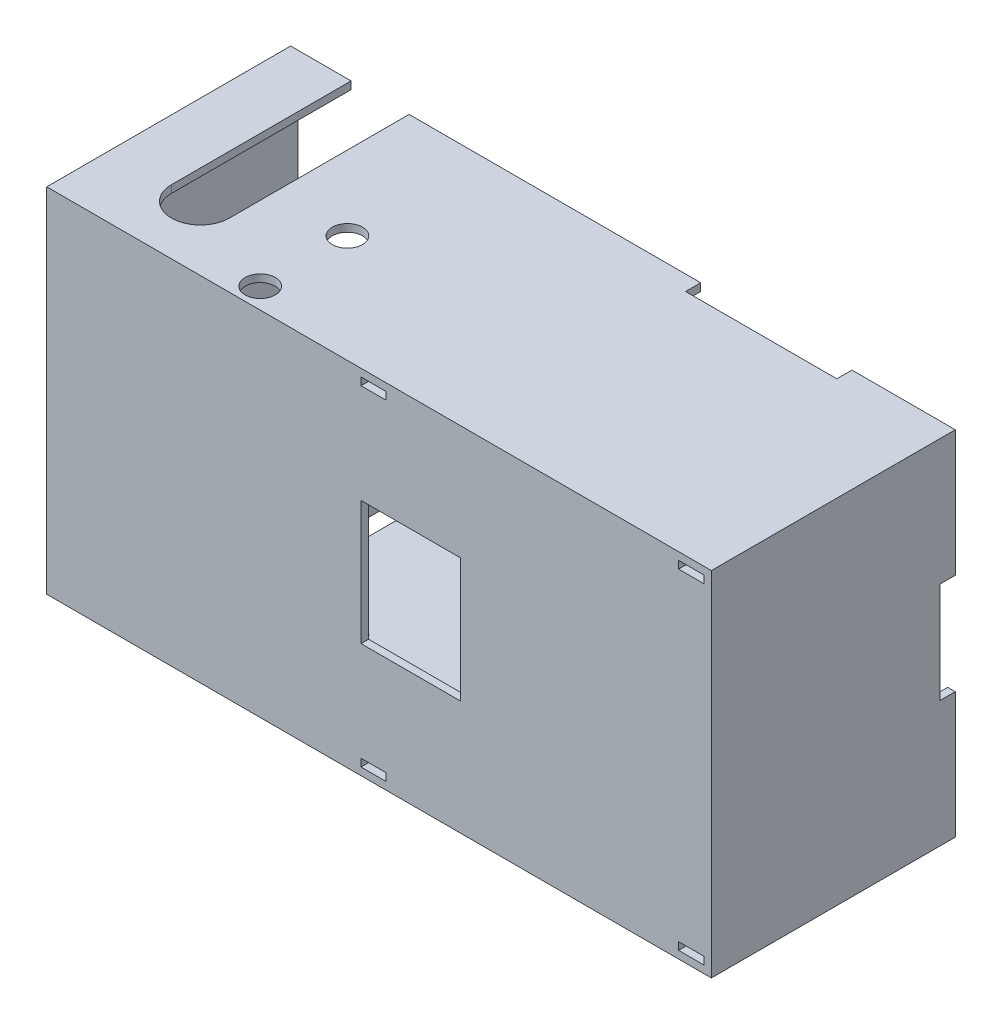
from build123d import *

# Parameters (mm, degrees)
SKETCH1_W                = 131.85
SKETCH1_H                = 70
BOSS_EXTRUDE1_DEPTH      = 1.5
SKETCH1_5_W              = 131.85
SKETCH1_5_H              = 70
SKETCH1_5_W_2            = 128.85
SKETCH1_5_H_2            = 67
BOSS_EXTRUDE2_DEPTH      = 46.887495374
SKETCH2_W                = 5.8
SKETCH2_H                = 7.525
BOSS_EXTRUDE3_DEPTH      = 67
CAVITY1_START            = -114.930353249
CAVITY1_DEPTH            = 49.266
CAVITY1_2_DEPTH          = 37.332
CAVITY1_START_2          = -120.030353249
CAVITY1_3_OUTLINE_W      = 2.55
CAVITY1_3_OUTLINE_H      = 5.1
CAVITY1_3_DEPTH          = 0.430353249
CAVITY1_START_3          = -9.75
CAVITY1_4_DEPTH          = 70
SKETCH5_W                = 8.75
SKETCH5_H                = 5
BOSS_EXTRUDE4_DEPTH      = 22.5
CUT_EXTRUDE3_REACH       = 139.739
SKETCH6_R                = 1.5
SKETCH6_R_2              = 1
CUT_EXTRUDE18_DEPTH      = 1.15
CUT_EXTRUDE18_DEPTH_BACK = 1.15
CUT_EXTRUDE18_START      = -2.5
CUT_EXTRUDE19_DEPTH      = 1.15
CUT_EXTRUDE19_DEPTH_BACK = 1.15
CUT_EXTRUDE19_START      = -19.7
SKETCH9_W                = 32.1
SKETCH9_H                = 12.2
SKETCH9_W_2              = 3.3625
BOSS_EXTRUDE5_DEPTH      = 40.087495374
SKETCH10_W               = 22.5
SKETCH10_H               = 15.7
CUT_EXTRUDE6_DEPTH       = 12.2
SKETCH11_R               = 0.75
CUT_EXTRUDE7_DEPTH       = 8
CUT_EXTRUDE9_REACH       = 149.525
SKETCH17_W               = 2.4375
SKETCH17_H               = 12.2
CUT_EXTRUDE13_DEPTH      = 7.525
SKETCH20_W               = 2.5
SKETCH20_H               = 3
BOSSBATTERYSTUBS_DEPTH   = 5.75
MIRROR10_COPY_1_SKETCH_W = 2.5
MIRROR10_COPY_1_SKETCH_H = 3
MIRROR10_COPY_1_DEPTH    = 5.75
SKETCH21_W               = 8
SKETCH21_H               = 4.2
BOSS_EXTRUDE6_DEPTH      = 1.35
MIRROR12_COPY_1_SKETCH_W = 8
MIRROR12_COPY_1_SKETCH_H = 4.2
MIRROR12_COPY_1_DEPTH    = 1.35
CUT_EXTRUDE16_REACH      = 145.655
SKETCH22_W               = 5
SKETCH22_H               = 1.5
SKETCH23_W               = 5
SKETCH23_H               = 1.5
CUT_EXTRUDE17_DEPTH      = 3
CUT_EXTRUDE23_REACH      = 145.156
SKETCH27_W               = 19.75
SKETCH27_H               = 24.6
CUT_EXTRUDE15_START      = -5.25
SKETCH19_R               = 3
CUT_EXTRUDE15_DEPTH      = 5.25
CUT_EXTRUDE24_START      = -5.25
SKETCH28_R               = 3
CUT_EXTRUDE24_DEPTH      = 5.25
CUT_EXTRUDE25_REACH      = 117.926
SKETCH29_W               = 8
SKETCH29_H               = 3
SKETCH30_W               = 5.1
SKETCH30_H               = 2.55
BOSSFRONTCAVITYFIX_DEPTH = 0.430353249
CUT_EXTRUDE26_DEPTH      = 4.8
CUT_EXTRUDE27_REACH      = 149.525
SKETCH32_W               = 30
SKETCH32_H               = 3
CUT_EXTRUDE28_REACH      = 154.358
SKETCH33_W               = 3
SKETCH33_H               = 20


# Read off the part's stored shape, not the designer's step: Cavity1
with BuildPart() as part:
    # Sketch1 → Boss-Extrude1 (new body)
    with BuildSketch(Plane.XY):
        with Locations((-55.175, 25.25)):
            Rectangle(SKETCH1_W, SKETCH1_H)
    extrude(amount=BOSS_EXTRUDE1_DEPTH)

    # Sketch1<5> → Boss-Extrude2 (add)
    with BuildSketch(Plane.XY):
        with Locations((-55.175, 25.25)):
            Rectangle(SKETCH1_5_W, SKETCH1_5_H)
        with Locations((-55.175, 25.25)):
            Rectangle(SKETCH1_5_W_2, SKETCH1_5_H_2, mode=Mode.SUBTRACT)
    extrude(amount=-BOSS_EXTRUDE2_DEPTH)

    # Sketch2 → Boss-Extrude3 (add)
    with BuildSketch(Plane.XZ.offset(-58.75)):
        with Locations((-76.95, -3.7625)):
            Rectangle(SKETCH2_W, SKETCH2_H)
    extrude(amount=BOSS_EXTRUDE3_DEPTH)

    # Cavity1 outline → Cavity1 (cut)
    with BuildSketch(Plane.YZ.offset(CAVITY1_START)):
        with BuildLine():
            Line((36.166540929, -4.011412776), (36.166540929, -7.525))
            Line((36.166540929, -7.525), (53.710540929, -7.525))
            Line((53.710540929, -7.525), (53.710540929, -4.011412776))
            ThreePointArc((53.710540929, -4.011412776), (44.938540929, 0.123), (36.166540929, -4.011412776))
        make_face()
        with BuildLine():
            Line((14.333459071, -7.525), (14.333459071, -4.011412776))
            ThreePointArc((14.333459071, -4.011412776), (5.561459071, 0.123), (-3.210540929, -4.011412776))
            Line((-3.210540929, -4.011412776), (-3.210540929, -7.525))
            Line((-3.210540929, -7.525), (14.333459071, -7.525))
        make_face()
    extrude(amount=CAVITY1_DEPTH, mode=Mode.SUBTRACT)

    # Cavity1 2 outline → Cavity1 2 (cut)
    with BuildSketch(Plane.YZ.offset(CAVITY1_START)):
        with BuildLine():
            Line((55.189540929, 0.225), (36.166540929, 0.225))
            Line((36.166540929, 0.225), (36.166540929, -4.011412776))
            ThreePointArc((36.166540929, -4.011412776), (44.938540929, 0.123), (53.710540929, -4.011412776))
            Line((53.710540929, -4.011412776), (53.710540929, -7.525))
            Line((53.710540929, -7.525), (55.189540929, -7.525))
            Line((55.189540929, -7.525), (55.189540929, 0.225))
        make_face()
        with BuildLine():
            Line((14.333459071, -4.011412776), (14.333459071, 0.225))
            Line((14.333459071, 0.225), (-4.689540929, 0.225))
            Line((-4.689540929, 0.225), (-4.689540929, -7.525))
            Line((-4.689540929, -7.525), (-3.210540929, -7.525))
            Line((-3.210540929, -7.525), (-3.210540929, -4.011412776))
            ThreePointArc((-3.210540929, -4.011412776), (5.561459071, 0.123), (14.333459071, -4.011412776))
        make_face()
    extrude(amount=CAVITY1_2_DEPTH, mode=Mode.SUBTRACT)

    # Cavity1 3 outline → Cavity1 3 (cut)
    with BuildSketch(Plane.YZ.offset(CAVITY1_START_2)):
        with Locations((44.938540929, -11.25)):
            Rectangle(CAVITY1_3_OUTLINE_W, CAVITY1_3_OUTLINE_H)
        with Locations((5.561459071, -11.25)):
            Rectangle(CAVITY1_3_OUTLINE_W, CAVITY1_3_OUTLINE_H)
    extrude(amount=CAVITY1_3_DEPTH, mode=Mode.SUBTRACT)

    # Cavity1 4 outline → Cavity1 4 (cut)
    with BuildSketch(Plane(origin=(0, 0, 0), x_dir=(1, 0, 0), z_dir=(0, 1, 0)).offset(CAVITY1_START_3)):
        with BuildLine():
            Line((-105.571853249, 13.174532151), (-105.571853249, 9.325467849))
            ThreePointArc((-105.571853249, 9.325467849), (-103.710353249, 8.5725), (-101.848853249, 9.325467849))
            Line((-101.848853249, 9.325467849), (-101.848853249, 13.174532151))
            ThreePointArc((-101.848853249, 13.174532151), (-103.710353249, 13.9275), (-105.571853249, 13.174532151))
        make_face()
    extrude(amount=CAVITY1_4_DEPTH, mode=Mode.SUBTRACT)

    # Sketch5 → Boss-Extrude4 (add)
    with BuildSketch(Plane(origin=(0, 0, 0), x_dir=(-1, 0, 0), z_dir=(0, 0, -1))):
        with Locations((82.85, 33.85)):
            Rectangle(SKETCH5_W, SKETCH5_H)
    boss_extrude4 = extrude(amount=BOSS_EXTRUDE4_DEPTH)

    # Sketch6 → Cut-Extrude3 (cut, up to next)
    with BuildSketch(Plane(origin=(0, 36.166540929, 0), x_dir=(1, 0, 0), z_dir=(0, 1, 0)), mode=Mode.PRIVATE) as cut_extrude3_sk1:
        with Locations(Location((-82.85, 19.9, 0), (0, 0, 270))):
            Circle(SKETCH6_R)
    cut_extrude3_tool1 = extrude(cut_extrude3_sk1.sketch, amount=-CUT_EXTRUDE3_REACH, mode=Mode.PRIVATE) & part.part
    # Sketch6 → Cut-Extrude3 (cut, up to next)
    with BuildSketch(Plane(origin=(0, 36.166540929, 0), x_dir=(1, 0, 0), z_dir=(0, 1, 0)), mode=Mode.PRIVATE) as cut_extrude3_sk2:
        with Locations(Location((-82.85, 2.6, 0), (0, 0, 270))):
            Circle(SKETCH6_R_2)
    cut_extrude3_tool2 = extrude(cut_extrude3_sk2.sketch, amount=-CUT_EXTRUDE3_REACH, mode=Mode.PRIVATE) & part.part
    cut_extrude3_1 = cut_extrude3_tool1.solids().sort_by_distance((-82.85, 36.166541, -19.9))[0]
    add(cut_extrude3_1, mode=Mode.SUBTRACT)
    cut_extrude3_2 = cut_extrude3_tool2.solids().sort_by_distance((-82.85, 36.166541, -2.6))[0]
    add(cut_extrude3_2, mode=Mode.SUBTRACT)
    cut_extrude3 = cut_extrude3_1 + cut_extrude3_2  # Cut-Extrude3 as one shape, for the pattern or mirror that repeats it

    # Sketch24 → Cut-Extrude18 (cut, two sides: drawn at the far end of the back side and taken through both)
    with BuildSketch(Plane(origin=(0, 36.35, 0), x_dir=(1, 0, 0), z_dir=(0, 1, 0)).offset(CUT_EXTRUDE18_START - CUT_EXTRUDE18_DEPTH_BACK)):
        Polygon((-82.85, 16.637970979), (-80.025, 18.26898549), (-80.025, 22.5), (-85.675, 22.5), (-85.675, 18.26898549), align=None)
    extrude(amount=CUT_EXTRUDE18_DEPTH + CUT_EXTRUDE18_DEPTH_BACK, mode=Mode.SUBTRACT)

    # Mirror15: Boss-Extrude4, Cut-Extrude3 across plane
    add(boss_extrude4.mirror(Plane(origin=(0, 25.25, 0), x_dir=(0, 0, 1), z_dir=(0, -1, 0))))
    add(cut_extrude3.mirror(Plane(origin=(0, 25.25, 0), x_dir=(0, 0, 1), z_dir=(0, -1, 0))), mode=Mode.SUBTRACT)

    # Sketch24<2> → Cut-Extrude19 (cut, two sides: drawn at the far end of the back side and taken through both)
    with BuildSketch(Plane(origin=(0, 36.35, 0), x_dir=(1, 0, 0), z_dir=(0, 1, 0)).offset(CUT_EXTRUDE19_START - CUT_EXTRUDE19_DEPTH_BACK)):
        Polygon((-82.85, 16.637970979), (-80.025, 18.26898549), (-80.025, 22.5), (-85.675, 22.5), (-85.675, 18.26898549), align=None)
    extrude(amount=CUT_EXTRUDE19_DEPTH + CUT_EXTRUDE19_DEPTH_BACK, mode=Mode.SUBTRACT)

    # Sketch9 → Boss-Extrude5 (add)
    with BuildSketch(Plane(origin=(0, 0, 0), x_dir=(-1, 0, 0), z_dir=(0, 0, -1))):
        with Locations((92.5375, 25.25)):
            Rectangle(SKETCH9_W, SKETCH9_H)
        with Locations((78.16875, 25.25)):
            Rectangle(SKETCH9_W_2, SKETCH9_H)
    extrude(amount=BOSS_EXTRUDE5_DEPTH)

    # Sketch10 → Cut-Extrude6 (cut)
    with BuildSketch(Plane(origin=(0, 31.35, 0), x_dir=(1, 0, 0), z_dir=(0, 1, 0))):
        with Locations((-92.5375, 32.237495374)):
            Rectangle(SKETCH10_W, SKETCH10_H)
    extrude(amount=-CUT_EXTRUDE6_DEPTH, mode=Mode.SUBTRACT)

    # Sketch11 → Cut-Extrude7 (cut)
    with BuildSketch(Plane(origin=(0, 0, -40.087495374), x_dir=(-1, 0, 0), z_dir=(0, 0, -1))):
        with Locations((106.1875, 25.25)):
            Circle(SKETCH11_R)
    cut_extrude7 = extrude(amount=-CUT_EXTRUDE7_DEPTH, mode=Mode.SUBTRACT)

    # Sketch13 → Cut-Extrude9 (cut, up to next)
    with BuildSketch(Plane(origin=(0, 60.25, 0), x_dir=(1, 0, 0), z_dir=(0, 1, 0)), mode=Mode.PRIVATE) as cut_extrude9_sk1:
        with BuildLine():
            Line((-109.1, 46.887495374), (-109.1, 11.25))
            ThreePointArc((-109.1, 11.25), (-103.35, 5.5), (-97.6, 11.25))
            Line((-97.6, 11.25), (-97.6, 46.887495374))
            Line((-97.6, 46.887495374), (-109.1, 46.887495374))
        make_face()
        with BuildLine():
            Line((-105.571853249, 9.325467849), (-105.571853249, 13.174532151))
            ThreePointArc((-105.571853249, 13.174532151), (-103.710353249, 13.9275), (-101.848853249, 13.174532151))
            Line((-101.848853249, 13.174532151), (-101.848853249, 9.325467849))
            ThreePointArc((-101.848853249, 9.325467849), (-103.710353249, 8.5725), (-105.571853249, 9.325467849))
        make_face(mode=Mode.SUBTRACT)
    cut_extrude9_tool1 = extrude(cut_extrude9_sk1.sketch, amount=-CUT_EXTRUDE9_REACH, mode=Mode.PRIVATE) & part.part
    cut_extrude9 = cut_extrude9_tool1.solids().sort_by_distance((-103.335225, 60.25, -27.427392))[0]
    add(cut_extrude9, mode=Mode.SUBTRACT)

    # Mirror4: Cut-Extrude9 across plane
    add(cut_extrude9.mirror(Plane(origin=(0, 25.25, 0), x_dir=(0, 0, 1), z_dir=(0, -1, 0))), mode=Mode.SUBTRACT)

    # Sketch17 → Cut-Extrude13 (cut)
    with BuildSketch(Plane(origin=(0, 0, -7.525), x_dir=(-1, 0, 0), z_dir=(0, 0, -1))):
        with Locations((75.26875, 25.25)):
            Rectangle(SKETCH17_W, SKETCH17_H)
    extrude(amount=-CUT_EXTRUDE13_DEPTH, mode=Mode.SUBTRACT)

    # Sketch20 → BossBatteryStubs (add)
    with BuildSketch(Plane(origin=(0, 0, 0), x_dir=(-1, 0, 0), z_dir=(0, 0, -1))):
        with Locations((29.25, 57.25)):
            Rectangle(SKETCH20_W, SKETCH20_H)
    bossbatterystubs = extrude(amount=BOSSBATTERYSTUBS_DEPTH)

    # Mirror9: BossBatteryStubs across plane
    add(bossbatterystubs.mirror(Plane.ZY.offset(19.5)))

    # Mirror10: BossBatteryStubs across plane
    add(bossbatterystubs.mirror(Plane(origin=(0, 25.25, 0), x_dir=(0, 0, 1), z_dir=(0, -1, 0))))

    # Mirror10 copy 1 sketch → Mirror10 copy 1 (add)
    with BuildSketch(Plane(origin=(-39, 50.5, 0), x_dir=(1, 0, 0), z_dir=(0, 0, -1))):
        with Locations((29.25, 57.25)):
            Rectangle(MIRROR10_COPY_1_SKETCH_W, MIRROR10_COPY_1_SKETCH_H)
    extrude(amount=MIRROR10_COPY_1_DEPTH)

    # Sketch21 → Boss-Extrude6 (add)
    with BuildSketch(Plane.XZ.offset(-58.75)):
        with Locations((5.25, -41.637495374)):
            Rectangle(SKETCH21_W, SKETCH21_H)
    boss_extrude6 = extrude(amount=BOSS_EXTRUDE6_DEPTH)

    # Mirror11: Boss-Extrude6 across plane
    add(boss_extrude6.mirror(Plane(origin=(-55.175, 0, 0), x_dir=(0, 0, 1), z_dir=(1, 0, 0))))

    # Mirror12: Boss-Extrude6 across plane
    add(boss_extrude6.mirror(Plane(origin=(0, 25.25, 0), x_dir=(0, 0, 1), z_dir=(0, -1, 0))))

    # Mirror12 copy 1 sketch → Mirror12 copy 1 (add)
    with BuildSketch(Plane(origin=(-110.35, -8.25, 0), x_dir=(-1, 0, 0), z_dir=(0, 1, 0))):
        with Locations((5.25, -41.637495374)):
            Rectangle(MIRROR12_COPY_1_SKETCH_W, MIRROR12_COPY_1_SKETCH_H)
    extrude(amount=MIRROR12_COPY_1_DEPTH)

    # Sketch22 → Cut-Extrude16 (cut, up to next)
    with BuildSketch(Plane.XY.offset(1.5), mode=Mode.PRIVATE) as cut_extrude16_sk1:
        with Locations((6.75, 58)):
            Rectangle(SKETCH22_W, SKETCH22_H)
    cut_extrude16_tool1 = extrude(cut_extrude16_sk1.sketch, amount=-CUT_EXTRUDE16_REACH, mode=Mode.PRIVATE) & part.part
    cut_extrude16 = cut_extrude16_tool1.solids().sort_by_distance((6.75, 58, 1.5))[0]
    add(cut_extrude16, mode=Mode.SUBTRACT)

    # Sketch23 → Cut-Extrude17 (cut)
    with BuildSketch(Plane.XY.offset(1.5)):
        with Locations((-56.25, 58)):
            Rectangle(SKETCH23_W, SKETCH23_H)
    cut_extrude17 = extrude(amount=-CUT_EXTRUDE17_DEPTH, mode=Mode.SUBTRACT)

    # Mirror13: Cut-Extrude16, Cut-Extrude17 across plane
    add(cut_extrude16.mirror(Plane(origin=(0, 25.25, 0), x_dir=(0, 0, 1), z_dir=(0, -1, 0))), mode=Mode.SUBTRACT)
    add(cut_extrude17.mirror(Plane(origin=(0, 25.25, 0), x_dir=(0, 0, 1), z_dir=(0, -1, 0))), mode=Mode.SUBTRACT)

    # Mirror14: Cut-Extrude7 across plane
    add(cut_extrude7.mirror(Plane(origin=(-92.5375, 0, 0), x_dir=(0, 0, 1), z_dir=(1, 0, 0))), mode=Mode.SUBTRACT)

    # Sketch27 → Cut-Extrude23 (cut, up to next)
    with BuildSketch(Plane(origin=(0, 0, 0), x_dir=(-1, 0, 0), z_dir=(0, 0, -1)), mode=Mode.PRIVATE) as cut_extrude23_sk1:
        with Locations((48.875, 25.25)):
            Rectangle(SKETCH27_W, SKETCH27_H)
    cut_extrude23_tool1 = extrude(cut_extrude23_sk1.sketch, amount=-CUT_EXTRUDE23_REACH, mode=Mode.PRIVATE) & part.part
    add(cut_extrude23_tool1.solids().sort_by_distance((-48.875, 25.25, 0))[0], mode=Mode.SUBTRACT)

    # Sketch19 → Cut-Extrude15 (cut)
    with BuildSketch(Plane.XZ.offset(9.75).offset(CUT_EXTRUDE15_START)):
        with Locations((-82.85, -19.9)):
            Circle(SKETCH19_R)
        with Locations((-82.85, -2.6)):
            Circle(SKETCH19_R)
    extrude(amount=CUT_EXTRUDE15_DEPTH, mode=Mode.SUBTRACT)

    # Sketch28 → Cut-Extrude24 (cut)
    with BuildSketch(Plane(origin=(0, 60.25, 0), x_dir=(1, 0, 0), z_dir=(0, 1, 0)).offset(CUT_EXTRUDE24_START)):
        with Locations((-82.85, 19.9)):
            Circle(SKETCH28_R)
        with Locations((-82.85, 2.6)):
            Circle(SKETCH28_R)
    extrude(amount=CUT_EXTRUDE24_DEPTH, mode=Mode.SUBTRACT)

    # Sketch29 → Cut-Extrude25 (cut, up to next)
    with BuildSketch(Plane(origin=(-76.4875, 0, 0), x_dir=(0, 0, -1), z_dir=(1, 0, 0)), mode=Mode.PRIVATE) as cut_extrude25_sk1:
        with Locations((28.387495374, 25.25)):
            Rectangle(SKETCH29_W, SKETCH29_H)
    cut_extrude25_tool1 = extrude(cut_extrude25_sk1.sketch, amount=-CUT_EXTRUDE25_REACH, mode=Mode.PRIVATE) & part.part
    add(cut_extrude25_tool1.solids().sort_by_distance((-76.4875, 25.25, -28.387495))[0], mode=Mode.SUBTRACT)

    # Sketch30 → BossFrontCavityFix (add)
    with BuildSketch(Plane(origin=(-120.030353249, 0, 0), x_dir=(0, 0, -1), z_dir=(1, 0, 0))):
        with Locations((11.25, 44.938540929)):
            Rectangle(SKETCH30_W, SKETCH30_H)
        with Locations((11.25, 5.561459071)):
            Rectangle(SKETCH30_W, SKETCH30_H)
    extrude(amount=BOSSFRONTCAVITYFIX_DEPTH)

    # Sketch31 → Cut-Extrude26 (cut)
    with BuildSketch(Plane(origin=(-76.4875, 0, 0), x_dir=(0, 0, -1), z_dir=(1, 0, 0))):
        Polygon((40.087495374, 19.15), (28.387495374, 19.15), (28.387495374, 23.75), (28.387495374, 26.75), (28.387495374, 31.35), (40.087495374, 31.35), align=None)
    extrude(amount=-CUT_EXTRUDE26_DEPTH, mode=Mode.SUBTRACT)

    # Sketch32 → Cut-Extrude27 (cut, up to next)
    with BuildSketch(Plane.XZ.offset(9.75), mode=Mode.PRIVATE) as cut_extrude27_sk1:
        with Locations((-24.75, -45.387495374)):
            Rectangle(SKETCH32_W, SKETCH32_H)
    cut_extrude27_tool1 = extrude(cut_extrude27_sk1.sketch, amount=-CUT_EXTRUDE27_REACH, mode=Mode.PRIVATE) & part.part
    cut_extrude27 = cut_extrude27_tool1.solids().sort_by_distance((-24.75, -9.75, -45.387495))[0]
    add(cut_extrude27, mode=Mode.SUBTRACT)

    # Mirror16: Cut-Extrude27 across plane
    add(cut_extrude27.mirror(Plane(origin=(0, 25.25, 0), x_dir=(0, 0, 1), z_dir=(0, -1, 0))), mode=Mode.SUBTRACT)

    # Sketch33 → Cut-Extrude28 (cut, up to next)
    with BuildSketch(Plane(origin=(10.75, 0, 0), x_dir=(0, 0, -1), z_dir=(1, 0, 0)), mode=Mode.PRIVATE) as cut_extrude28_sk1:
        with Locations((45.387495374, 25.25)):
            Rectangle(SKETCH33_W, SKETCH33_H)
    cut_extrude28_tool1 = extrude(cut_extrude28_sk1.sketch, amount=-CUT_EXTRUDE28_REACH, mode=Mode.PRIVATE) & part.part
    cut_extrude28 = cut_extrude28_tool1.solids().sort_by_distance((10.75, 25.25, -45.387495))[0]
    add(cut_extrude28, mode=Mode.SUBTRACT)

    # Mirror17: Cut-Extrude28 across plane
    add(cut_extrude28.mirror(Plane(origin=(-55.175, 0, 0), x_dir=(0, 0, 1), z_dir=(1, 0, 0))), mode=Mode.SUBTRACT)


solid = part.part
